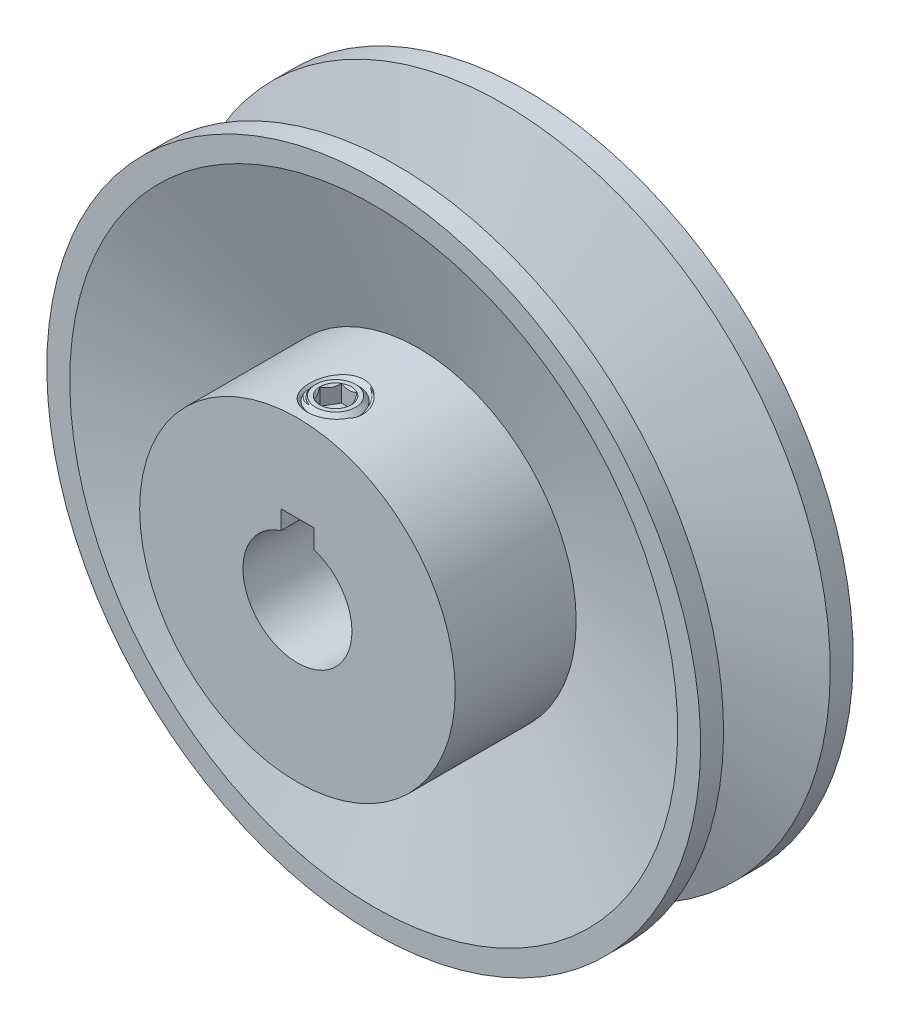
from build123d import *

# Parameters (mm, degrees)
SKETCH2_W          = 11.1125
SKETCH2_H          = 22.987
SKETCH3_R          = 7.9375
CUT_EXTRUDE1_DEPTH = 33.3375
SKETCH4_W          = 4.7625
SKETCH4_H          = 4.7625
CUT_EXTRUDE2_DEPTH = 33.3375
CUT_EXTRUDE3_REACH = 90.024
SKETCH5_R          = 3.086805556
CUT_SWEEP1_PITCH   = 1.411111111
CUT_SWEEP2_PITCH   = 1.411111111
CUT_EXTRUDE5_DEPTH = 2.48046875


with BuildPart() as part:
    # Sketch1 → Revolve1 (revolve)
    with BuildSketch(Plane(origin=(0, 0, 0), x_dir=(0, 0, -1), z_dir=(1, 0, 0)), mode=Mode.PRIVATE) as revolve1_sk:
        Polygon((7.7724, 47.625), (11.1125, 47.625), (11.1125, 44.2849), (3.873057334, 20.60575), (7.9375, 20.60575), (7.9375, 0), (-11.1125, 0), (-11.1125, 22.987), (-4.601078519, 22.987), (-11.1125, 44.2849), (-11.1125, 47.625), (-7.7724, 47.625), (-2.918925432, 31.75), (2.918925432, 31.75), align=None)
    revolve(revolve1_sk.sketch.rotate(Axis((0, 0, 22.225), (0, 0, -1)), 180), axis=Axis((0, 0, 22.225), (0, 0, -1)))

    # Sketch2 → Revolve2 (revolve)
    with BuildSketch(Plane(origin=(0, 0, 0), x_dir=(0, 0, -1), z_dir=(1, 0, 0)), mode=Mode.PRIVATE) as revolve2_sk:
        with Locations((-16.66875, 11.4935)):
            Rectangle(SKETCH2_W, SKETCH2_H)
    revolve(revolve2_sk.sketch.rotate(Axis((0, 0, -11.1125), (0, 0, 1)), 180), axis=Axis((0, 0, -11.1125), (0, 0, 1)))

    # Sketch3 → Cut-Extrude1 (cut)
    with BuildSketch(Plane(origin=(0, 0, 22.225), x_dir=(-1, 0, 0), z_dir=(0, 0, -1))):
        with Locations(Location((0, 0, 0), (0, 0, 270))):
            Circle(SKETCH3_R)
    extrude(amount=CUT_EXTRUDE1_DEPTH, mode=Mode.SUBTRACT)

    # Sketch4 → Cut-Extrude2 (cut)
    with BuildSketch(Plane(origin=(0, 0, 22.225), x_dir=(-1, 0, 0), z_dir=(0, 0, -1))):
        with Locations((0, 7.9375)):
            Rectangle(SKETCH4_W, SKETCH4_H)
    extrude(amount=CUT_EXTRUDE2_DEPTH, mode=Mode.SUBTRACT)

    # Sketch5 → Cut-Extrude3 (cut, up to next)
    with BuildSketch(Plane(origin=(0, 22.987, 0), x_dir=(-1, 0, 0), z_dir=(0, 1, 0)), mode=Mode.PRIVATE) as cut_extrude3_sk1:
        with Locations(Location((0, 16.66875, 0), (0, 0, 90))):
            Circle(SKETCH5_R)
    cut_extrude3_tool1 = extrude(cut_extrude3_sk1.sketch, amount=-CUT_EXTRUDE3_REACH, mode=Mode.PRIVATE) & part.part
    add(cut_extrude3_tool1.solids().sort_by_distance((0, 22.987, 16.66875))[0], mode=Mode.SUBTRACT)

    # Cut-Sweep1: the profile of Sketch7 screwed along a right-hand helix of 17.29 turns, 8 arcs to a turn; built about Z, then put on its axis
    cut_sweep1_z = Axis((0, 0, 0), (0, 0, 1))
    cut_sweep1_corners = [(2.975827818, 0, -1.367013889), (2.975827818, 0, -0.044097222), (3.96875, 0, -0.617361111), (3.96875, 0, -0.79375)]
    with BuildLine(mode=Mode.PRIVATE) as cut_sweep1_profile:
        Line(cut_sweep1_corners[0], cut_sweep1_corners[1])
        Line(cut_sweep1_corners[1], cut_sweep1_corners[2])
        Line(cut_sweep1_corners[2], cut_sweep1_corners[3])
        Line(cut_sweep1_corners[3], cut_sweep1_corners[0])
    cut_sweep1_cap = Face(cut_sweep1_profile.wire())
    cut_sweep1_turn_angles = [0, 22.5, 45, 67.5, 90, 112.5, 135, 157.5, 180, 202.5, 225, 247.5, 270, 292.5, 315, 337.5, 360]
    cut_sweep1_turn_weights = [1, 0.9238795325112867, 1, 0.9238795325112867, 1, 0.9238795325112867, 1, 0.9238795325112867, 1, 0.9238795325112867, 1, 0.9238795325112867, 1, 0.9238795325112867, 1, 0.9238795325112867, 1]
    cut_sweep1_turn_rails = [Edge.make_bspline([Vector(p[0], p[1], 0).rotate(cut_sweep1_z, cut_sweep1_turn_angles[k]) / cut_sweep1_turn_weights[k] + Vector(0, 0, p[2] + CUT_SWEEP1_PITCH * cut_sweep1_turn_angles[k] / 360) for k in range(17)], [0, 0, 0, 1, 1, 2, 2, 3, 3, 4, 4, 5, 5, 6, 6, 7, 7, 8, 8, 8], 2, cut_sweep1_turn_weights) for p in cut_sweep1_corners]
    cut_sweep1_turn_sides = [Face.make_surface_from_curves(cut_sweep1_turn_rails[p[0]], cut_sweep1_turn_rails[p[1]]) for p in [(0, 1), (1, 2), (2, 3), (3, 0)]]
    cut_sweep1_last_angles = [6120, 6142.5, 6165, 6187.5, 6210, 6217.2, 6224.4]
    cut_sweep1_last_weights = [1, 0.9238795325112867, 1, 0.9238795325112867, 1, 0.9921147013144325, 1]
    cut_sweep1_last_rails = [Edge.make_bspline([Vector(p[0], p[1], 0).rotate(cut_sweep1_z, cut_sweep1_last_angles[k]) / cut_sweep1_last_weights[k] + Vector(0, 0, p[2] + CUT_SWEEP1_PITCH * cut_sweep1_last_angles[k] / 360) for k in range(7)], [0, 0, 0, 1, 1, 2, 2, 3, 3, 3], 2, cut_sweep1_last_weights) for p in cut_sweep1_corners]
    cut_sweep1_last_sides = [Face.make_surface_from_curves(cut_sweep1_last_rails[p[0]], cut_sweep1_last_rails[p[1]]) for p in [(0, 1), (1, 2), (2, 3), (3, 0)]]
    cut_sweep1 = Plane(origin=(0, 22.987, 16.66875), x_dir=(0, 0, 1), z_dir=(0, -1, 0)) * Solid(Shell([*[p.moved(Location((0, 0, CUT_SWEEP1_PITCH * i))) for i in range(17) for p in cut_sweep1_turn_sides], *cut_sweep1_last_sides, cut_sweep1_cap, cut_sweep1_cap.rotate(cut_sweep1_z, 6224.4).moved(Location((0, 0, CUT_SWEEP1_PITCH * 6224.4 / 360)))]))
    add(cut_sweep1, mode=Mode.SUBTRACT)

    # Cut-Extrude4 cone 1 section (through the dimple's axis) → Cut-Extrude4 (revolve, cut)
    with BuildSketch(Plane(origin=(0, 22.987, 16.66875), x_dir=(0, 0, 1), z_dir=(1, 0, 0))):
        Polygon((0, 0), (4.121507259, 0), (0, 4.121507259), align=None)
    revolve(axis=Axis((0, 22.987, 16.66875), (0, -1, 0)), mode=Mode.SUBTRACT)


with BuildPart() as body_2:
    # Sketch9 → Revolve3 (revolve)
    with BuildSketch(Plane(origin=(0, 0, 0), x_dir=(0, 0, -1), z_dir=(1, 0, 0))):
        Polygon((-20.6375, 16.118800811), (-20.6375, 21.917699189), (-19.568199189, 22.987), (-16.66875, 22.987), (-16.66875, 15.0495), (-19.568199189, 15.0495), align=None)
    revolve(axis=Axis((0, 22.987, 16.66875), (0, -1, 0)))

    # Cut-Sweep2: the profile of Sketch11 profile screwed along a right-hand helix of 6.625 turns, 8 arcs to a turn; built about Z, then put on its axis
    cut_sweep2_z = Axis((0, 0, 0), (0, 0, 1))
    cut_sweep2_corners = [(3.052206448, 0, -0.088194444), (3.052206448, 0, 0.088194444), (3.96905, 0, 0.617534316), (3.96905, 0, -0.617534316)]
    with BuildLine(mode=Mode.PRIVATE) as cut_sweep2_profile:
        Line(cut_sweep2_corners[0], cut_sweep2_corners[1])
        Line(cut_sweep2_corners[1], cut_sweep2_corners[2])
        Line(cut_sweep2_corners[2], cut_sweep2_corners[3])
        Line(cut_sweep2_corners[3], cut_sweep2_corners[0])
    cut_sweep2_cap = Face(cut_sweep2_profile.wire())
    cut_sweep2_turn_angles = [0, 22.5, 45, 67.5, 90, 112.5, 135, 157.5, 180, 202.5, 225, 247.5, 270, 292.5, 315, 337.5, 360]
    cut_sweep2_turn_weights = [1, 0.9238795325112867, 1, 0.9238795325112867, 1, 0.9238795325112867, 1, 0.9238795325112867, 1, 0.9238795325112867, 1, 0.9238795325112867, 1, 0.9238795325112867, 1, 0.9238795325112867, 1]
    cut_sweep2_turn_rails = [Edge.make_bspline([Vector(p[0], p[1], 0).rotate(cut_sweep2_z, cut_sweep2_turn_angles[k]) / cut_sweep2_turn_weights[k] + Vector(0, 0, p[2] + CUT_SWEEP2_PITCH * cut_sweep2_turn_angles[k] / 360) for k in range(17)], [0, 0, 0, 1, 1, 2, 2, 3, 3, 4, 4, 5, 5, 6, 6, 7, 7, 8, 8, 8], 2, cut_sweep2_turn_weights) for p in cut_sweep2_corners]
    cut_sweep2_turn_sides = [Face.make_surface_from_curves(cut_sweep2_turn_rails[p[0]], cut_sweep2_turn_rails[p[1]]) for p in [(0, 1), (1, 2), (2, 3), (3, 0)]]
    cut_sweep2_last_angles = [2160, 2182.5, 2205, 2227.5, 2250, 2272.5, 2295, 2317.5, 2340, 2362.5, 2385]
    cut_sweep2_last_weights = [1, 0.9238795325112867, 1, 0.9238795325112867, 1, 0.9238795325112867, 1, 0.9238795325112867, 1, 0.9238795325112715, 1]
    cut_sweep2_last_rails = [Edge.make_bspline([Vector(p[0], p[1], 0).rotate(cut_sweep2_z, cut_sweep2_last_angles[k]) / cut_sweep2_last_weights[k] + Vector(0, 0, p[2] + CUT_SWEEP2_PITCH * cut_sweep2_last_angles[k] / 360) for k in range(11)], [0, 0, 0, 1, 1, 2, 2, 3, 3, 4, 4, 5, 5, 5], 2, cut_sweep2_last_weights) for p in cut_sweep2_corners]
    cut_sweep2_last_sides = [Face.make_surface_from_curves(cut_sweep2_last_rails[p[0]], cut_sweep2_last_rails[p[1]]) for p in [(0, 1), (1, 2), (2, 3), (3, 0)]]
    cut_sweep2 = Plane(origin=(0, 22.987, 16.66875), x_dir=(0, 0, 1), z_dir=(0, -1, 0)) * Solid(Shell([*[p.moved(Location((0, 0, CUT_SWEEP2_PITCH * i))) for i in range(6) for p in cut_sweep2_turn_sides], *cut_sweep2_last_sides, cut_sweep2_cap, cut_sweep2_cap.rotate(cut_sweep2_z, 2385).moved(Location((0, 0, CUT_SWEEP2_PITCH * 2385 / 360)))]))
    add(cut_sweep2, mode=Mode.SUBTRACT)

    # Sketch12 → Cut-Extrude5 (cut)
    with BuildSketch(Plane(origin=(0, 22.987, 0), x_dir=(1, 0, 0), z_dir=(0, 1, 0))):
        Polygon((2.291358881, -16.66875), (1.14567944, -14.684375), (-1.14567944, -14.684375), (-2.291358881, -16.66875), (-1.14567944, -18.653125), (1.14567944, -18.653125), align=None)
    extrude(amount=-CUT_EXTRUDE5_DEPTH, mode=Mode.SUBTRACT)

    # Cut-Extrude6 cone 1 section (through the dimple's axis) → Cut-Extrude6 (revolve, cut)
    with BuildSketch(Plane(origin=(0, 22.987, 16.66875), x_dir=(0, 0, 1), z_dir=(1, 0, 0))):
        Polygon((0, 0), (2.291358881, 0), (0, 2.291358881), align=None)
    revolve(axis=Axis((0, 22.987, 16.66875), (0, -1, 0)), mode=Mode.SUBTRACT)


solid = Compound([part.part, body_2.part])
